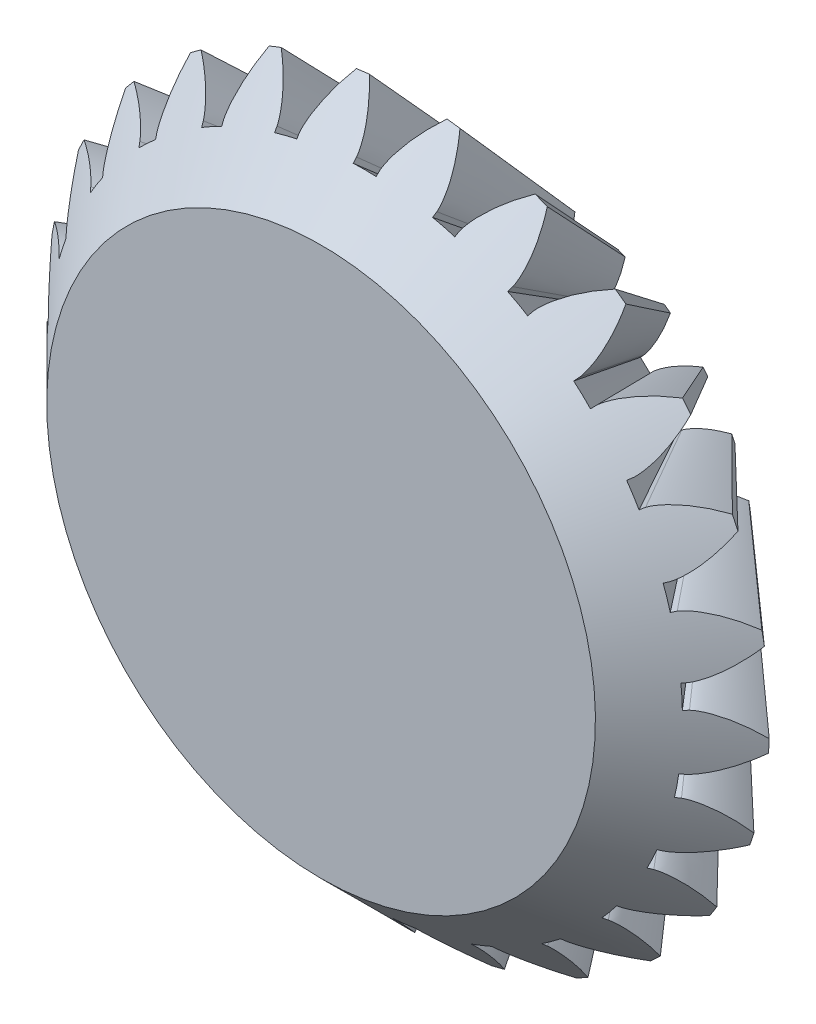
from build123d import *

# Parameters (mm, degrees)
PATTERN_CIRCULAR_1_COUNT = 25


# Read off the part's stored shape, not the designer's step: 旋转1
with BuildPart() as part:
    # 旋转1 outline → 旋转1 (revolve)
    with BuildSketch(Plane.XZ):
        Polygon((0, -30.075378798), (0, -48.064875529), (16.245070375, -48.064875529), (22.811417767, -54.63122292), (39.621320344, -39.621320344), (30.075378798, -30.075378798), align=None)
    revolve(axis=Axis((0, 0, 0), (0, 0, 1)))

    # 草图3 → 切除-放样2 section 0
    with BuildSketch(Plane(origin=(0, 10.983495706, -10.983495706), x_dir=(1, 0, 0), z_dir=(0, 0.7071067811865466, 0.7071067811865486)), mode=Mode.PRIVATE) as loft_2_s0:
        with BuildLine():
            Line((1.270532924, 34.278179945), (1.270532924, 33.726076648))
            ThreePointArc((1.270532924, 33.726076648), (0.010224932, 33.749998451), (-1.250097324, 33.726840301))
            Line((-1.250097324, 33.726840301), (-1.270532924, 34.278179945))
            add(Edge.make_bspline(
                [(-1.270532924, 34.278179945), (-1.27217747, 34.305947738), (-1.278700683, 34.383691078), (-1.298528729, 34.53002275), (-1.341498011, 34.767299814), (-1.443894201, 35.204296936), (-1.645708236, 35.855950563), (-1.92530697, 36.556663927), (-2.271250135, 37.280164929), (-2.608108183, 37.902755351), (-2.894628689, 38.391188332), (-3.261307095, 38.972306529), (-3.730633518, 39.655387997), (-4.2161475, 40.297083656), (-4.637107638, 40.809075241), (-4.898477222, 41.112337367), (-4.97562321, 41.200645307)],
                knots=[0, 0, 0, 0, 0, 0.005376748, 0.015083688, 0.02853182, 0.046610139, 0.092110525, 0.146842495, 0.174208853, 0.201574955, 0.228941013, 0.256307345, 0.307035032, 0.361767351, 0.384438255, 0.384438255, 0.384438255, 0.384438255, 0.384438255], degree=4))
            ThreePointArc((-4.97562321, 41.200645307), (0, 41.5), (4.97562321, 41.200645307))
            add(Edge.make_bspline(
                [(1.270532924, 34.278179945), (1.27217747, 34.305947738), (1.278700683, 34.383691078), (1.298528729, 34.53002275), (1.341498011, 34.767299814), (1.443894201, 35.204296936), (1.645708236, 35.855950563), (1.92530697, 36.556663927), (2.271250135, 37.280164929), (2.608108183, 37.902755351), (2.894628689, 38.391188332), (3.261307095, 38.972306529), (3.730633518, 39.655387997), (4.2161475, 40.297083656), (4.637107638, 40.809075241), (4.898477222, 41.112337367), (4.97562321, 41.200645307)],
                knots=[0, 0, 0, 0, 0, 0.005376748, 0.015083688, 0.02853182, 0.046610139, 0.092110525, 0.146842495, 0.174208853, 0.201574955, 0.228941013, 0.256307345, 0.307035032, 0.361767351, 0.384438255, 0.384438255, 0.384438255, 0.384438255, 0.384438255], degree=4))
        make_face()
    loft_2 = loft([loft_2_s0.sketch, Vertex(0, 0, -75)], mode=Mode.SUBTRACT)

    # 阵列(圆周)1: 切除-放样2 ×25 about axis
    pattern_circular_1_axis = Axis((0, 0, -54.63122292), (0, 0, 1))
    for i in range(1, PATTERN_CIRCULAR_1_COUNT):
        add(loft_2.rotate(pattern_circular_1_axis, i * 360 / PATTERN_CIRCULAR_1_COUNT), mode=Mode.SUBTRACT)


solid = part.part
